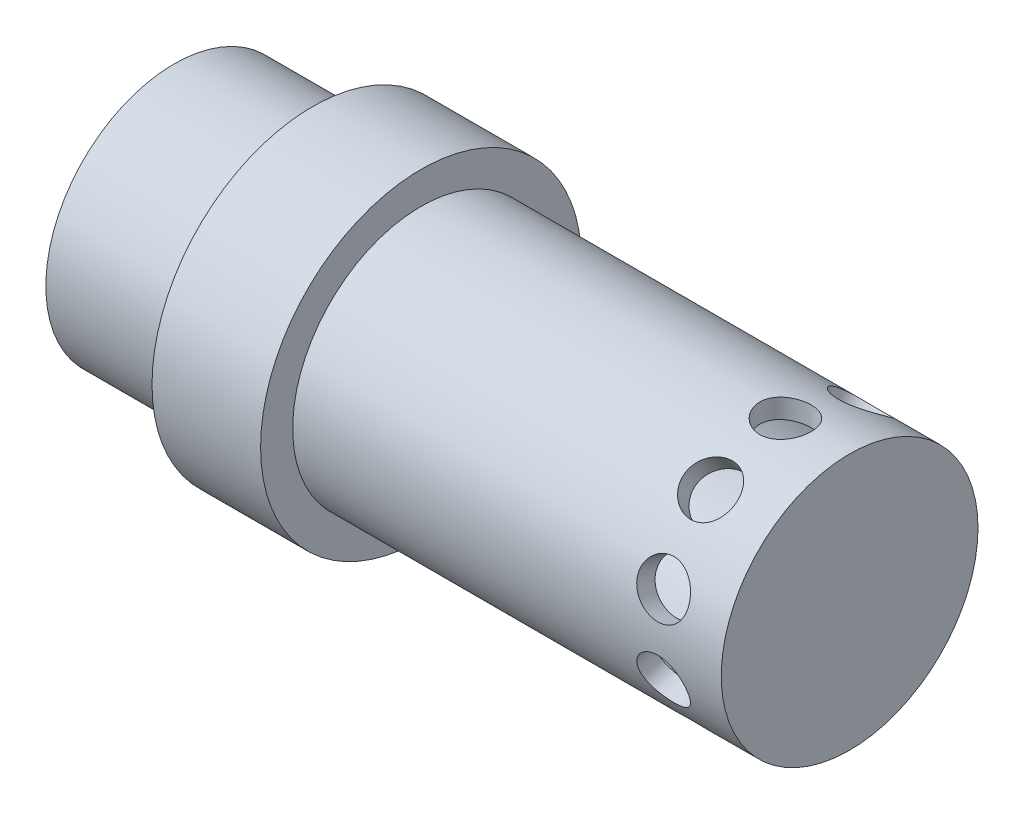
from build123d import *

# Parameters (mm, degrees)
CUT_EXTRUDE1_REACH = 113.025
SKETCH2_R          = 4
CIRPATTERN1_COUNT  = 10


with BuildPart() as part:
    # Sketch1 → Revolve1 (revolve)
    with BuildSketch(Plane.XY):
        Polygon((0, 0), (0, 20), (-66.784359743, 20), (-66.784359743, 25), (-83.702975636, 25), (-83.702975636, 20), (-105.24487755, 20), (-105.24487755, 17), (-3, 17), (-3, 0), align=None)
    revolve(axis=Axis((27.57498519, 0, 0), (-1, 0, 0)))

    # Sketch2 → Cut-Extrude1 (cut, up to next)
    with BuildSketch(Plane(origin=(0, 0, 0), x_dir=(1, 0, 0), z_dir=(0, 1, 0)), mode=Mode.PRIVATE) as cut_extrude1_sk1:
        with Locations((-10, 0)):
            Circle(SKETCH2_R)
    cut_extrude1_tool1 = extrude(cut_extrude1_sk1.sketch, amount=CUT_EXTRUDE1_REACH, mode=Mode.PRIVATE) & part.part
    cut_extrude1 = cut_extrude1_tool1.solids().sort_by_distance((-10, 0, 0))[0]
    add(cut_extrude1, mode=Mode.SUBTRACT)

    # CirPattern1: Cut-Extrude1 ×10 about axis
    cirpattern1_axis = Axis((27.57498519, 0, 0), (-1, 0, 0))
    for i in range(1, CIRPATTERN1_COUNT):
        add(cut_extrude1.rotate(cirpattern1_axis, i * 360 / CIRPATTERN1_COUNT), mode=Mode.SUBTRACT)


solid = part.part
